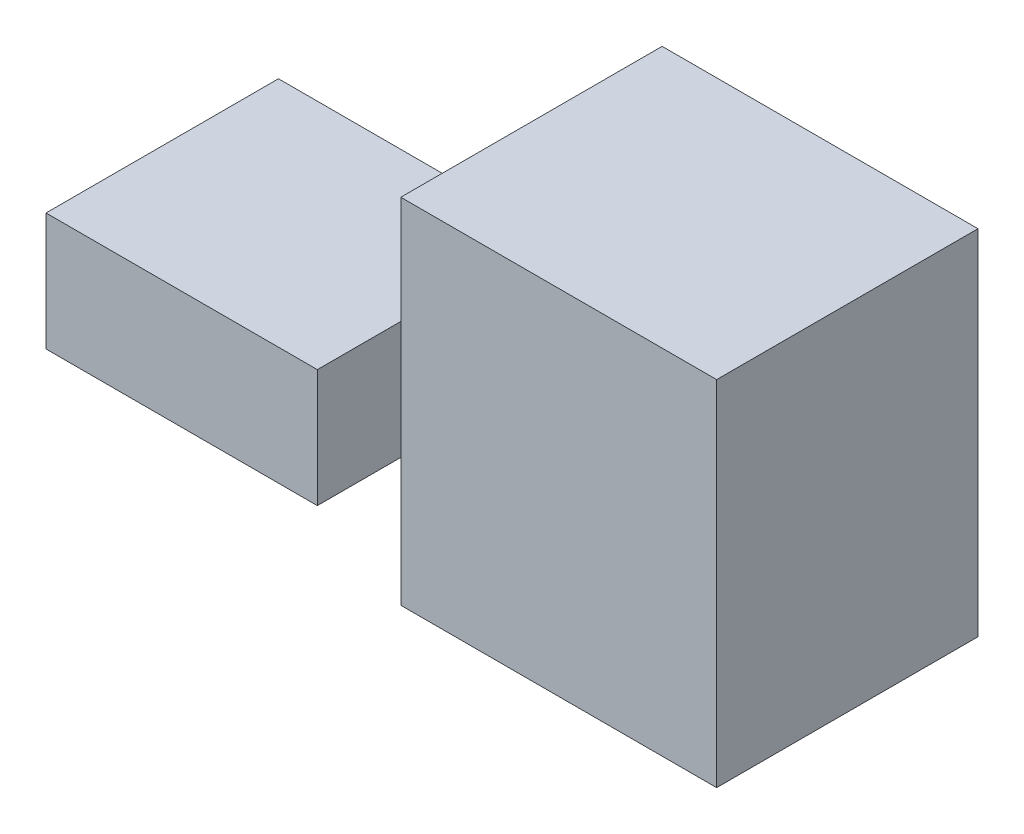
from build123d import *

# Parameters (mm, degrees)
BOSS_EXTRUDE1_OUTLINE_W = 115.170832384
BOSS_EXTRUDE1_OUTLINE_H = 98.678589084
BOSS_EXTRUDE1_DEPTH     = 50
SKETCH2_W               = 134.074286241
SKETCH2_H               = 110.934517328
BOSS_EXTRUDE2_DEPTH     = 150


# Read off the part's stored shape, not the designer's step: Boss-Extrude1
with BuildPart() as part:
    # Boss-Extrude1 outline → Boss-Extrude1 (new body)
    with BuildSketch(Plane(origin=(0, 0, 0), x_dir=(1, 0, 0), z_dir=(0, 1, 0))):
        with Locations((-73.802788771, 6.871768042)):
            Rectangle(BOSS_EXTRUDE1_OUTLINE_W, BOSS_EXTRUDE1_OUTLINE_H)
    extrude(amount=BOSS_EXTRUDE1_DEPTH)


with BuildPart() as body_2:
    # Sketch2 → Boss-Extrude2 (new body)
    with BuildSketch(Plane(origin=(0, 0, 0), x_dir=(1, 0, 0), z_dir=(0, 1, 0))):
        with Locations((105.158462238, -5.924836033)):
            Rectangle(SKETCH2_W, SKETCH2_H)
    extrude(amount=BOSS_EXTRUDE2_DEPTH)


solid = Compound([part.part, body_2.part])
